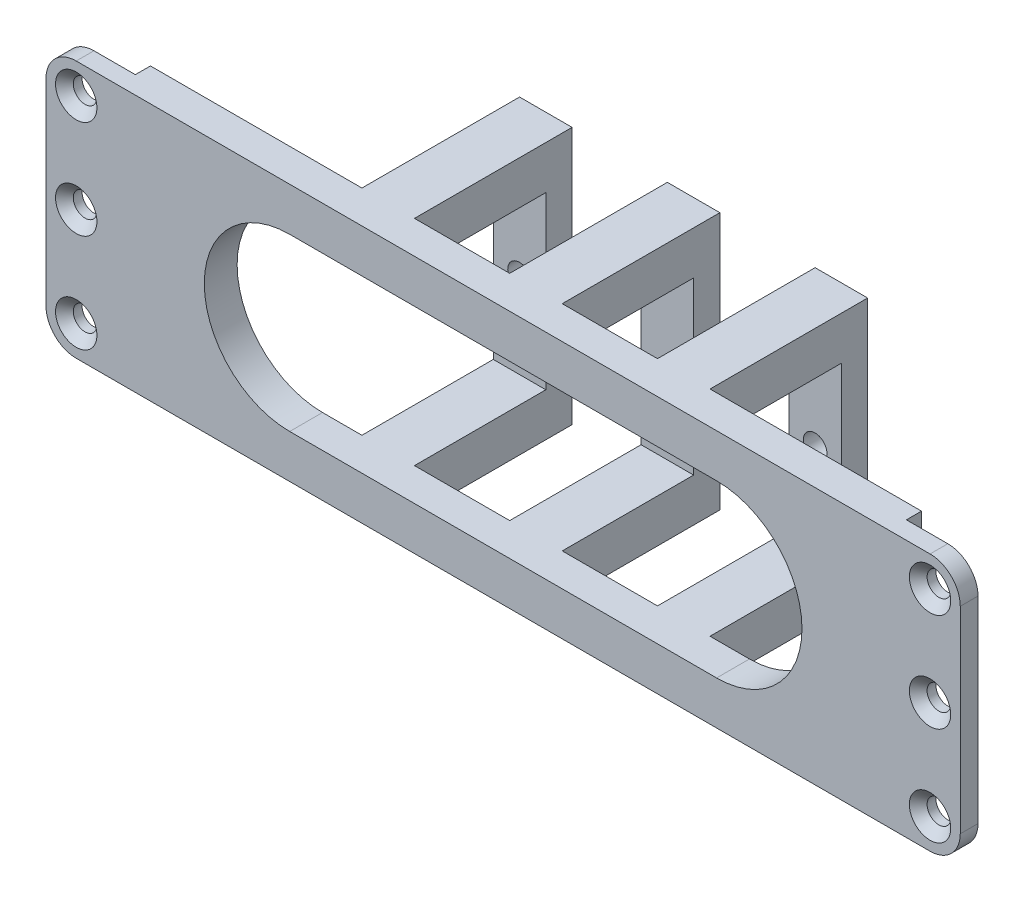
from build123d import *

# Parameters (mm, degrees)
SKETCH1_W                = 118
SKETCH1_H                = 40
SKETCH1_W_2              = 11
BOSS_EXTRUDE1_DEPTH      = 3
BOSS_EXTRUDE2_START      = -5
SKETCH1_3_W              = 118
SKETCH1_3_H              = 40
BOSS_EXTRUDE2_DEPTH      = 5
FILLET1_R                = 5
BOSS_EXTRUDE3_DEPTH      = 4
LPATTERN1_COUNT          = 2
LPATTERN1_PITCH          = 22.5
LPATTERN1_COL_COUNT      = 2
LPATTERN1_COL_PITCH      = 22.5
M3_CLEARANCE_HOLE1_D     = 3.6
M3_CLEARANCE_HOLE1_DEPTH = 9
M3_CLEARANCE_HOLE1_TIP   = 1.081549114
CUT_EXTRUDE2_DEPTH       = 79.364532794
SKETCH12_W               = 5
SKETCH12_H               = 39.2
CUT_EXTRUDE3_DEPTH       = 0.3
SKETCH13_W               = 5
SKETCH13_H               = 39.2
CUT_EXTRUDE4_DEPTH       = 0.3
CUT_EXTRUDE5_START       = -0.3
CUT_EXTRUDE5_DEPTH       = 0.3
SKETCH16_W               = 14.5
SKETCH16_H               = 6.6
CUT_EXTRUDE7_DEPTH       = 3


# Read off the part's stored shape, not the designer's step: CSK for M3 Flat Head Machine Screw1
with BuildPart() as part:
    # Sketch1 → Boss-Extrude1 (new body)
    # profile 1 of 3: a face of its own
    with BuildSketch(Plane.XY):
        Rectangle(SKETCH1_W, SKETCH1_H)
        with BuildLine():
            ThreePointArc((-32.5, -13), (-45.5, 0), (-32.5, 13))
            Line((-32.5, 13), (32.5, 13))
            ThreePointArc((32.5, 13), (45.5, 0), (32.5, -13))
            Line((32.5, -13), (-32.5, -13))
        make_face(mode=Mode.SUBTRACT)
    # profile 2 of 3: a face of its own
    with BuildSketch(Plane.XY):
        with Locations((-64.5, 0)):
            Rectangle(SKETCH1_W_2, SKETCH1_H)
    # profile 3 of 3: a face of its own
    with BuildSketch(Plane.XY):
        with Locations((64.5, 0)):
            Rectangle(SKETCH1_W_2, SKETCH1_H)
    extrude(amount=BOSS_EXTRUDE1_DEPTH)

    # Sketch1<3> → Boss-Extrude2 (add)
    with BuildSketch(Plane.XY.offset(BOSS_EXTRUDE2_START)):
        Rectangle(SKETCH1_3_W, SKETCH1_3_H)
        with BuildLine():
            ThreePointArc((-32.5, -13), (-45.5, 0), (-32.5, 13))
            Line((-32.5, 13), (32.5, 13))
            ThreePointArc((32.5, 13), (45.5, 0), (32.5, -13))
            Line((32.5, -13), (-32.5, -13))
        make_face(mode=Mode.SUBTRACT)
    extrude(amount=BOSS_EXTRUDE2_DEPTH)

    # CSK for M3 Flat Head Machine Screw1 outl → CSK for M3 Flat Head Machine Screw1 (revolve, cut)
    with BuildSketch(Plane(origin=(65, 0, 0), x_dir=(1, 0, 0), z_dir=(0, -1, 0))):
        Polygon((0, 0), (1.8, 0), (1.8, 1.65), (3.15, 3), (0, 3), align=None)
    revolve(axis=Axis((65, 0, 0), (0, 0, 1)), mode=Mode.SUBTRACT)

    # CSK for M3 Flat Head Machine Screw1 2 ou → CSK for M3 Flat Head Machine Screw1 2 (revolve, cut)
    with BuildSketch(Plane(origin=(-65, 0, 0), x_dir=(1, 0, 0), z_dir=(0, -1, 0))):
        Polygon((0, 0), (1.8, 0), (1.8, 1.65), (3.15, 3), (0, 3), align=None)
    revolve(axis=Axis((-65, 0, 0), (0, 0, 1)), mode=Mode.SUBTRACT)

    # CSK for M3 Flat Head Machine Screw1 3 ou → CSK for M3 Flat Head Machine Screw1 3 (revolve, cut)
    with BuildSketch(Plane(origin=(-65, -15, 0), x_dir=(1, 0, 0), z_dir=(0, -1, 0))):
        Polygon((0, 0), (1.8, 0), (1.8, 1.65), (3.15, 3), (0, 3), align=None)
    revolve(axis=Axis((-65, -15, 0), (0, 0, 1)), mode=Mode.SUBTRACT)

    # CSK for M3 Flat Head Machine Screw1 4 ou → CSK for M3 Flat Head Machine Screw1 4 (revolve, cut)
    with BuildSketch(Plane(origin=(65, 15, 0), x_dir=(1, 0, 0), z_dir=(0, -1, 0))):
        Polygon((0, 0), (1.8, 0), (1.8, 1.65), (3.15, 3), (0, 3), align=None)
    revolve(axis=Axis((65, 15, 0), (0, 0, 1)), mode=Mode.SUBTRACT)

    # CSK for M3 Flat Head Machine Screw1 5 ou → CSK for M3 Flat Head Machine Screw1 5 (revolve, cut)
    with BuildSketch(Plane(origin=(65, -15, 0), x_dir=(1, 0, 0), z_dir=(0, -1, 0))):
        Polygon((0, 0), (1.8, 0), (1.8, 1.65), (3.15, 3), (0, 3), align=None)
    revolve(axis=Axis((65, -15, 0), (0, 0, 1)), mode=Mode.SUBTRACT)

    # CSK for M3 Flat Head Machine Screw1 6 ou → CSK for M3 Flat Head Machine Screw1 6 (revolve, cut)
    with BuildSketch(Plane(origin=(-65, 15, 0), x_dir=(1, 0, 0), z_dir=(0, -1, 0))):
        Polygon((0, 0), (1.8, 0), (1.8, 1.65), (3.15, 3), (0, 3), align=None)
    revolve(axis=Axis((-65, 15, 0), (0, 0, 1)), mode=Mode.SUBTRACT)

    # Fillet1
    fillet1_edges = [part.edges().sort_by_distance(p)[0] for p in [
        (-70, -20, 1.5),
        (-70, 20, 1.5),
        (70, 20, 1.5),
        (70, -20, 1.5),
    ]]
    fillet(fillet1_edges, radius=FILLET1_R)

    # Sketch5 → Boss-Extrude3 (add, symmetric)
    with BuildSketch(Plane(origin=(0, 0, 0), x_dir=(0, 0, -1), z_dir=(1, 0, 0))):
        Polygon((5, -13), (5, -20), (26, -20), (26, 20), (5, 20), (5, 13), (22, 13), (22, -13), align=None)
    boss_extrude3 = extrude(amount=BOSS_EXTRUDE3_DEPTH, both=True)

    # LPattern1: Boss-Extrude3 ×2
    with Locations(*[(i * LPATTERN1_PITCH, 0, 0) for i in range(1, LPATTERN1_COUNT)]):
        add(boss_extrude3)

    # LPattern1 col: Boss-Extrude3 ×2
    with Locations(*[(-i * LPATTERN1_COL_PITCH, 0, 0) for i in range(1, LPATTERN1_COL_COUNT)]):
        add(boss_extrude3)

    # M3 Clearance Hole1
    with Locations(Plane(origin=(0, 0, -26), x_dir=(-1, 0, 0), z_dir=(0, 0, -1))):
        with Locations((-22.5, 0), (22.5, 0)):
            Hole(M3_CLEARANCE_HOLE1_D / 2, depth=M3_CLEARANCE_HOLE1_DEPTH)
            with Locations((0, 0, -(M3_CLEARANCE_HOLE1_DEPTH + M3_CLEARANCE_HOLE1_TIP / 2))):  # 118° drill point
                Cone(0, M3_CLEARANCE_HOLE1_D / 2, M3_CLEARANCE_HOLE1_TIP, mode=Mode.SUBTRACT)

    # Sketch10 → Cut-Extrude2 (cut, through all)
    with BuildSketch(Plane.XY.offset(3)):
        with BuildLine():
            Line((70, -15), (70, 15))
            ThreePointArc((70, 15), (68.535533906, 18.535533906), (65, 20))
            Line((65, 20), (-65, 20))
            ThreePointArc((-65, 20), (-68.535533906, 18.535533906), (-70, 15))
            Line((-70, 15), (-70, -15))
            ThreePointArc((-70, -15), (-68.535533906, -18.535533906), (-65, -20))
            Line((-65, -20), (65, -20))
            ThreePointArc((65, -20), (68.535533906, -18.535533906), (70, -15))
        make_face()
        with BuildLine():
            Line((69.6, -15), (69.6, 15))
            ThreePointArc((69.6, 15), (68.252691193, 18.252691193), (65, 19.6))
            Line((65, 19.6), (-65, 19.6))
            ThreePointArc((-65, 19.6), (-68.252691193, 18.252691193), (-69.6, 15))
            Line((-69.6, 15), (-69.6, -15))
            ThreePointArc((-69.6, -15), (-68.252691193, -18.252691193), (-65, -19.6))
            Line((-65, -19.6), (65, -19.6))
            ThreePointArc((65, -19.6), (68.252691193, -18.252691193), (69.6, -15))
        make_face(mode=Mode.SUBTRACT)
    extrude(amount=-CUT_EXTRUDE2_DEPTH, mode=Mode.SUBTRACT)

    # Sketch12 → Cut-Extrude3 (cut)
    with BuildSketch(Plane(origin=(59, 0, 0), x_dir=(0, 0, -1), z_dir=(1, 0, 0))):
        with Locations((2.5, 0)):
            Rectangle(SKETCH12_W, SKETCH12_H)
    extrude(amount=-CUT_EXTRUDE3_DEPTH, mode=Mode.SUBTRACT)

    # Sketch13 → Cut-Extrude4 (cut)
    with BuildSketch(Plane.ZY.offset(59)):
        with Locations((-2.5, 0)):
            Rectangle(SKETCH13_W, SKETCH13_H)
    extrude(amount=-CUT_EXTRUDE4_DEPTH, mode=Mode.SUBTRACT)

    # Sketch14 → Cut-Extrude5 (cut)
    with BuildSketch(Plane(origin=(0, 0, 0), x_dir=(-1, 0, 0), z_dir=(0, 0, -1)).offset(CUT_EXTRUDE5_START)):
        with BuildLine():
            Line((-65, -19.6), (-58.7, -19.6))
            Line((-58.7, -19.6), (-58.7, 19.6))
            Line((-58.7, 19.6), (-65, 19.6))
            ThreePointArc((-65, 19.6), (-68.252691193, 18.252691193), (-69.6, 15))
            Line((-69.6, 15), (-69.6, -15))
            ThreePointArc((-69.6, -15), (-68.252691193, -18.252691193), (-65, -19.6))
        make_face()
        with BuildLine():
            Line((58.7, -19.6), (65, -19.6))
            ThreePointArc((65, -19.6), (68.252691193, -18.252691193), (69.6, -15))
            Line((69.6, -15), (69.6, 15))
            ThreePointArc((69.6, 15), (68.252691193, 18.252691193), (65, 19.6))
            Line((65, 19.6), (58.7, 19.6))
            Line((58.7, 19.6), (58.7, -19.6))
        make_face()
    extrude(amount=CUT_EXTRUDE5_DEPTH, mode=Mode.SUBTRACT)

    # Sketch16 → Cut-Extrude7 (cut)
    with BuildSketch(Plane(origin=(0, 0, -5), x_dir=(-1, 0, 0), z_dir=(0, 0, -1))):
        with Locations((11.25, 16.3)):
            Rectangle(SKETCH16_W, SKETCH16_H)
        with BuildLine():
            Line((58.7, -19.6), (58.7, 19.6))
            Line((58.7, 19.6), (26.5, 19.6))
            Line((26.5, 19.6), (26.5, 13))
            Line((26.5, 13), (32.5, 13))
            ThreePointArc((32.5, 13), (45.5, 0), (32.5, -13))
            Line((32.5, -13), (26.5, -13))
            Line((26.5, -13), (26.5, -19.6))
            Line((26.5, -19.6), (58.7, -19.6))
        make_face()
        with Locations((11.25, -16.3)):
            Rectangle(SKETCH16_W, SKETCH16_H)
        with Locations((-11.25, -16.3)):
            Rectangle(SKETCH16_W, SKETCH16_H)
        with Locations((-11.25, 16.3)):
            Rectangle(SKETCH16_W, SKETCH16_H)
        with BuildLine():
            Line((-58.7, 19.6), (-58.7, -19.6))
            Line((-58.7, -19.6), (-26.5, -19.6))
            Line((-26.5, -19.6), (-26.5, -13))
            Line((-26.5, -13), (-32.5, -13))
            ThreePointArc((-32.5, -13), (-45.5, 0), (-32.5, 13))
            Line((-32.5, 13), (-26.5, 13))
            Line((-26.5, 13), (-26.5, 19.6))
            Line((-26.5, 19.6), (-58.7, 19.6))
        make_face()
    extrude(amount=-CUT_EXTRUDE7_DEPTH, mode=Mode.SUBTRACT)


solid = part.part
